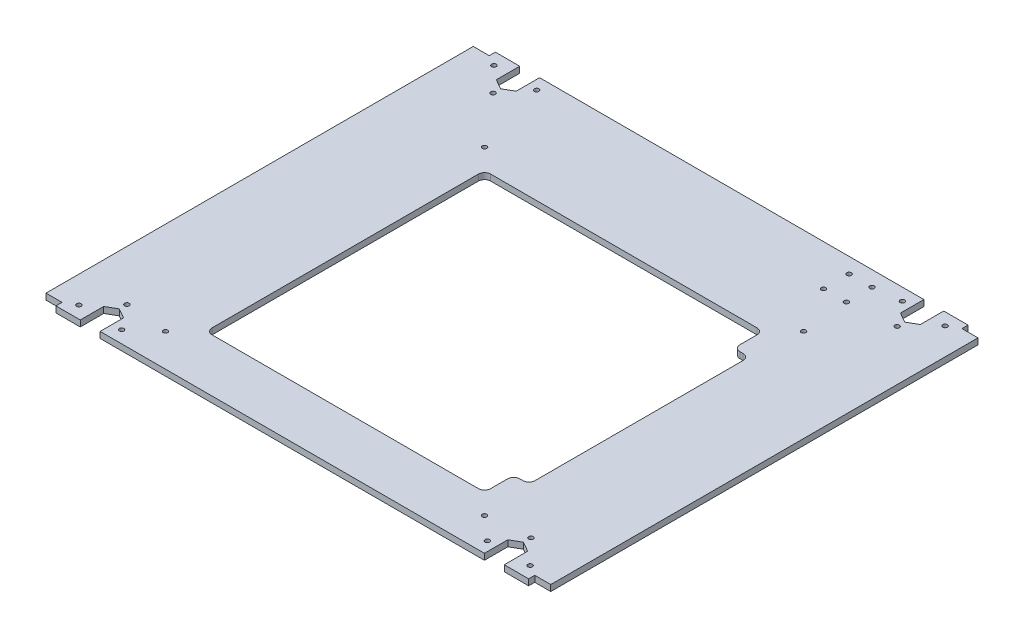
from build123d import *

# Parameters (mm, degrees)
SKETCH1_R               = 1.5
SKETCH1_W               = 182.468094358
SKETCH1_H               = 182.468094358
BOSS_EXTRUDE1_DEPTH     = 4
CUT_EXTRUDE1_DEPTH      = 10
CUT_EXTRUDE1_DEPTH_BACK = 10
SKETCH7_W               = 144.235193926
SKETCH7_H               = 4
FILLET1_R               = 4


with BuildPart() as part:
    # Sketch1 → Boss-Extrude1 (new body)
    with BuildSketch(Plane(origin=(0, 0, 0), x_dir=(1, 0, 0), z_dir=(0, 1, 0))):
        Polygon((154.855, -139.95), (165.325, -139.95), (165.325, 139.95), (154.855, 139.95), (154.855, 143.95), (138.875, 143.95), (138.875, 128.61722325), (132.375, 124.864446501), (125.875, 128.61722325), (125.875, 143.95), (-125.875, 143.95), (-125.875, 128.61722325), (-132.375, 124.864446501), (-138.875, 128.61722325), (-138.875, 143.95), (-154.855, 143.95), (-154.855, 139.95), (-165.325, 139.95), (-165.325, -139.95), (-154.855, -139.95), (-154.855, -143.95), (-138.875, -143.95), (-138.875, -128.61722325), (-132.375, -124.864446501), (-125.875, -128.61722325), (-125.875, -143.95), (125.875, -143.95), (125.875, -128.61722325), (132.375, -124.864446501), (138.875, -128.61722325), (138.875, -143.95), (154.855, -143.95), align=None)
        with Locations((-147.795, -135.95)):
            Circle(SKETCH1_R, mode=Mode.SUBTRACT)
        with Locations((-132.375, -119.95)):
            Circle(SKETCH1_R, mode=Mode.SUBTRACT)
        with Locations((-119.795, -135.95)):
            Circle(SKETCH1_R, mode=Mode.SUBTRACT)
        with Locations((-104.5, -122.5)):
            Circle(SKETCH1_R, mode=Mode.SUBTRACT)
        with Locations((0, -18)):
            Rectangle(SKETCH1_W, SKETCH1_H, mode=Mode.SUBTRACT)
        with Locations((119.795, -135.95)):
            Circle(SKETCH1_R, mode=Mode.SUBTRACT)
        with Locations((104.5, -122.5)):
            Circle(SKETCH1_R, mode=Mode.SUBTRACT)
        with Locations((147.795, -135.95)):
            Circle(SKETCH1_R, mode=Mode.SUBTRACT)
        with Locations((132.375, -119.95)):
            Circle(SKETCH1_R, mode=Mode.SUBTRACT)
        with Locations((-104.5, 86.5)):
            Circle(SKETCH1_R, mode=Mode.SUBTRACT)
        with Locations((-132.375, 119.95)):
            Circle(SKETCH1_R, mode=Mode.SUBTRACT)
        with Locations((-147.795, 135.95)):
            Circle(SKETCH1_R, mode=Mode.SUBTRACT)
        with Locations((-119.795, 135.95)):
            Circle(SKETCH1_R, mode=Mode.SUBTRACT)
        with Locations((104.5, 86.5)):
            Circle(SKETCH1_R, mode=Mode.SUBTRACT)
        with Locations((86.915968312, 117.1513625)):
            Circle(SKETCH1_R, mode=Mode.SUBTRACT)
        with Locations((101.875, 117.1513625)):
            Circle(SKETCH1_R, mode=Mode.SUBTRACT)
        with Locations((86.915968312, 133.95)):
            Circle(SKETCH1_R, mode=Mode.SUBTRACT)
        with Locations((101.875, 133.95)):
            Circle(SKETCH1_R, mode=Mode.SUBTRACT)
        with Locations((119.795, 135.95)):
            Circle(SKETCH1_R, mode=Mode.SUBTRACT)
        with Locations((132.375, 119.95)):
            Circle(SKETCH1_R, mode=Mode.SUBTRACT)
        with Locations((147.795, 135.95)):
            Circle(SKETCH1_R, mode=Mode.SUBTRACT)
    extrude(amount=BOSS_EXTRUDE1_DEPTH)

    # Sketch7 → Cut-Extrude1 (cut, two sides: drawn at the far end of the back side and taken through both)
    with BuildSketch(Plane.ZY.offset(-91.234047179).offset(-CUT_EXTRUDE1_DEPTH_BACK)):
        with Locations((18, 2)):
            Rectangle(SKETCH7_W, SKETCH7_H)
    extrude(amount=CUT_EXTRUDE1_DEPTH + CUT_EXTRUDE1_DEPTH_BACK, mode=Mode.SUBTRACT)

    # Fillet1
    fillet1_edges = [part.edges().sort_by_distance(p)[0] for p in [
        (101.234047179, 2, -54.117596963),
        (101.234047179, 2, 90.117596963),
        (91.234047179, 2, 109.234047179),
        (-91.234047179, 2, 109.234047179),
        (-91.234047179, 2, -73.234047179),
        (91.234047179, 2, -73.234047179),
        (91.234047179, 2, -54.117596963),
        (91.234047179, 2, 90.117596963),
    ]]
    fillet(fillet1_edges, radius=FILLET1_R)


solid = part.part
